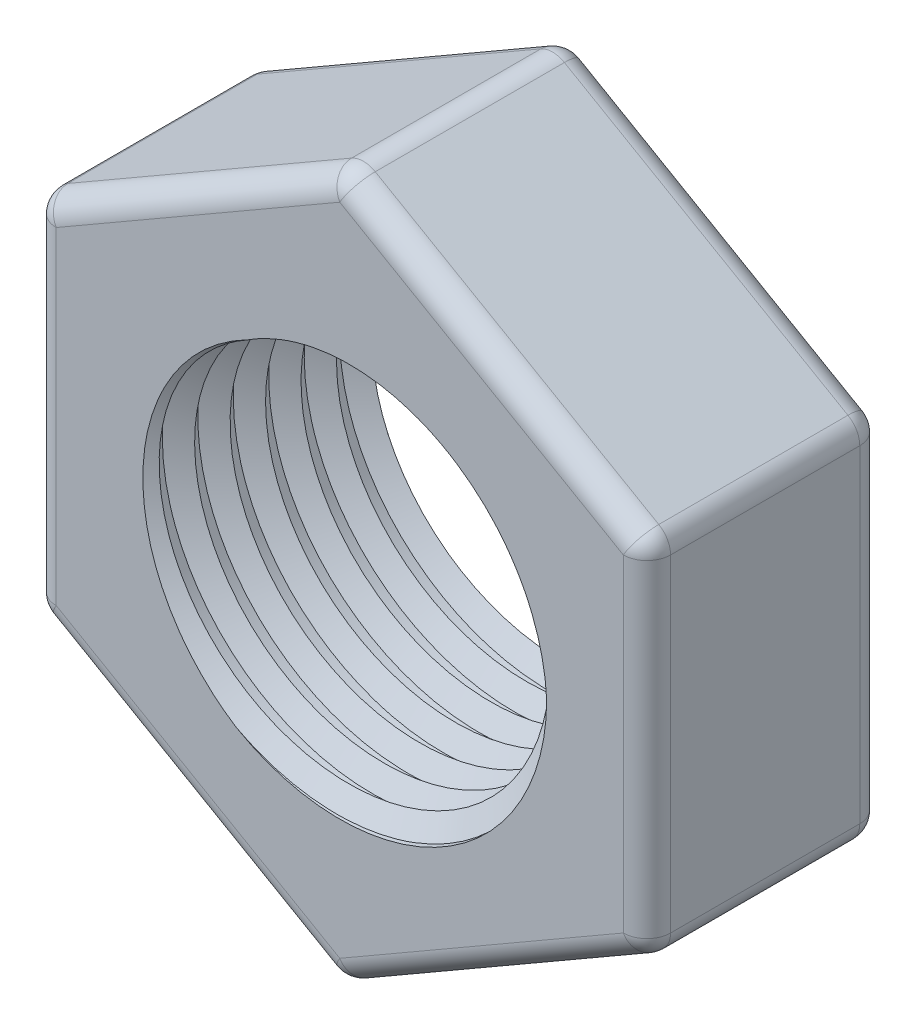
from build123d import *

# Parameters (mm, degrees)
SKETCH1_R           = 17.5
BOSS_EXTRUDE1_DEPTH = 20
SWEEP1_PITCH        = 3
SKETCH4_W           = 51.961524228
SKETCH4_H           = 43.133029748
CUT_EXTRUDE1_DEPTH  = 40
SKETCH5_W           = 51.961524228
SKETCH5_H           = 6.797099363
CUT_EXTRUDE2_DEPTH  = 40
FILLET1_R           = 2


with BuildPart() as part:
    # Sketch1 → Boss-Extrude1 (new body)
    with BuildSketch(Plane.XY):
        Polygon((0, -30), (25.980762114, -15), (25.980762114, 15), (0, 30), (-25.980762114, 15), (-25.980762114, -15), align=None)
        Circle(SKETCH1_R, mode=Mode.SUBTRACT)
    extrude(amount=BOSS_EXTRUDE1_DEPTH)

    # Sweep1: the profile of Sketch3 profile screwed along a left-hand helix of 20 turns, 10 arcs to a turn; built about Z, then put on its axis
    sweep1_z = Axis((0, 0, 0), (0, 0, 1))
    sweep1_corners = [(17.5003, 0, -1.000173205), (15.767949192, 0, 0), (17.5003, 0, 1.000173205)]
    with BuildLine(mode=Mode.PRIVATE) as sweep1_profile:
        Line(sweep1_corners[0], sweep1_corners[1])
        Line(sweep1_corners[1], sweep1_corners[2])
        Line(sweep1_corners[2], sweep1_corners[0])
    sweep1_cap = Face(sweep1_profile.wire())
    sweep1_turn_angles = [0, -18, -36, -54, -72, -90, -108, -126, -144, -162, -180, -198, -216, -234, -252, -270, -288, -306, -324, -342, -360]
    sweep1_turn_weights = [1, 0.9510565162951535, 1, 0.9510565162951535, 1, 0.9510565162951535, 1, 0.9510565162951535, 1, 0.9510565162951535, 1, 0.9510565162951535, 1, 0.9510565162951535, 1, 0.9510565162951535, 1, 0.9510565162951535, 1, 0.9510565162951535, 1]
    sweep1_turn_rails = [Edge.make_bspline([Vector(p[0], p[1], 0).rotate(sweep1_z, sweep1_turn_angles[k]) / sweep1_turn_weights[k] + Vector(0, 0, p[2] + -SWEEP1_PITCH * sweep1_turn_angles[k] / 360) for k in range(21)], [0, 0, 0, 1, 1, 2, 2, 3, 3, 4, 4, 5, 5, 6, 6, 7, 7, 8, 8, 9, 9, 10, 10, 10], 2, sweep1_turn_weights) for p in sweep1_corners]
    sweep1_turn_sides = [Face.make_surface_from_curves(sweep1_turn_rails[p[0]], sweep1_turn_rails[p[1]]) for p in [(0, 1), (1, 2), (2, 0)]]
    sweep1 = Plane(origin=(0, 0, 0), x_dir=(1, 0, 0), z_dir=(0, 0, 1)) * Solid(Shell([*[p.moved(Location((0, 0, SWEEP1_PITCH * i))) for i in range(20) for p in sweep1_turn_sides], sweep1_cap, sweep1_cap.rotate(sweep1_z, -7200).moved(Location((0, 0, -SWEEP1_PITCH * -7200 / 360)))]))
    add(sweep1)

    # Sketch4 → Cut-Extrude1 (cut, symmetric)
    with BuildSketch(Plane(origin=(0, 0, 0), x_dir=(1, 0, 0), z_dir=(0, 1, 0))):
        with Locations((0, -41.566514874)):
            Rectangle(SKETCH4_W, SKETCH4_H)
    extrude(amount=CUT_EXTRUDE1_DEPTH, both=True, mode=Mode.SUBTRACT)

    # Sketch5 → Cut-Extrude2 (cut, symmetric)
    with BuildSketch(Plane(origin=(0, 0, 0), x_dir=(1, 0, 0), z_dir=(0, 1, 0))):
        with Locations((0, 3.398549682)):
            Rectangle(SKETCH5_W, SKETCH5_H)
    extrude(amount=CUT_EXTRUDE2_DEPTH, both=True, mode=Mode.SUBTRACT)

    # Fillet1
    fillet1_edges = [part.edges().sort_by_distance(p)[0] for p in [
        (-25.980762114, -15, 10),
        (-25.980762114, 15, 10),
        (0, 30, 10),
        (25.980762114, 15, 10),
        (25.980762114, -15, 10),
        (0, -30, 10),
        (25.980762114, 0, 20),
        (12.990381057, 22.5, 20),
        (-12.990381057, 22.5, 20),
        (-25.980762114, 0, 20),
        (-12.990381057, -22.5, 20),
        (-25.980762114, 0, 0),
        (-12.990381057, 22.5, 0),
        (12.990381057, 22.5, 0),
        (25.980762114, 0, 0),
        (12.990381057, -22.5, 0),
        (-12.990381057, -22.5, 0),
        (12.990381057, -22.5, 20),
    ]]
    fillet(fillet1_edges, radius=FILLET1_R)


solid = part.part
